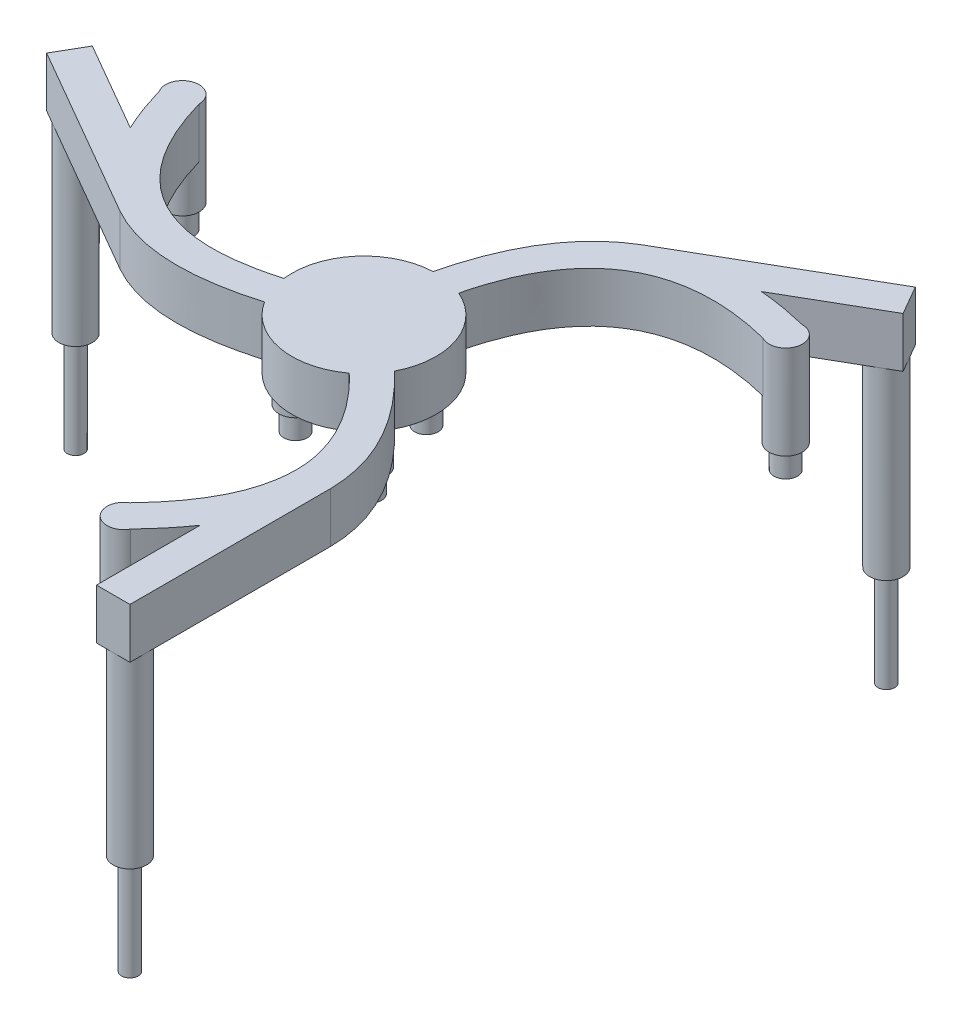
from build123d import *

# Parameters (mm, degrees)
BOSS_EXTRUDE2_DEPTH = 15
SKETCH4_R           = 5
BOSS_EXTRUDE3_DEPTH = 55
SKETCH5_R           = 2.5
BOSS_EXTRUDE5_DEPTH = 30
BOSS_EXTRUDE6_START = 20
SKETCH6_R           = 5
BOSS_EXTRUDE6_DEPTH = 20
SKETCH9_R           = 5
BOSS_EXTRUDE7_DEPTH = 20
SKETCH10_R          = 5
SKETCH10_R_2        = 3.5
CUT_EXTRUDE1_DEPTH  = 7


# Read off the part's stored shape, not the designer's step: Boss-Extrude2
with BuildPart() as part:
    # Boss-Extrude2 outline → Boss-Extrude2 (new body)
    with BuildSketch(Plane(origin=(0, 0, 0), x_dir=(1, 0, 0), z_dir=(0, 1, 0))):
        with BuildLine():
            ThreePointArc((-79.301270189, 80.000000278), (-85.640172505, 84.817399775), (-88.584206568, 77.419989152))
            add(Edge.make_bspline(
                [(-88.584206568, 77.419989152), (-86.367928891, 69.782262616), (-83.408582461, 63.514951385)],
                knots=[0.02157692, 0.02157692, 0.02157692, 0.151234515, 0.151234515, 0.151234515], degree=2))
            Line((-83.408582461, 63.514951385), (-110.262794416, 79.019237886))
            Line((-110.262794416, 79.019237886), (-115.262794416, 70.358983849))
            Line((-115.262794416, 70.358983849), (-63.301270189, 40.358983849))
            add(Edge.make_bspline(
                [(-63.301270189, 40.358983849), (-45.646570728, 30.396854404), (-18.218994006, 38.458495307)],
                knots=[0.484299762, 0.484299762, 0.484299762, 0.954512817, 0.954512817, 0.954512817], degree=2))
            ThreePointArc((-18.218994006, 38.458495307), (-3.922368216, 28.792616834), (12.885706155, 32.705589052))
            add(Edge.make_bspline(
                [(29.05383915, 7.474920109), (25.9728438, 20.230319759), (12.885706155, 32.705589052)],
                knots=[0.594463111, 0.594463111, 0.594463111, 0.969398026, 0.969398026, 0.969398026], degree=2))
            ThreePointArc((29.05383915, 7.474920109), (29.76251984, 3.767281878), (30, 0))
            add(Edge.make_bspline(
                [(13.669872981, -33.676914536), (30.204968933, -16.604131181), (30, 0)],
                knots=[0, 0, 0, 0.484954637, 0.484954637, 0.484954637], degree=2))
            ThreePointArc((13.669872981, -33.676914536), (12.667333455, -41.575264764), (20.545696107, -40.426167838))
            add(Edge.make_bspline(
                [(20.545696107, -40.426167838), (26.052022476, -34.6879518), (30, -28.991426998)],
                knots=[0.02157692, 0.02157692, 0.02157692, 0.151234515, 0.151234515, 0.151234515], degree=2))
            Line((30, -28.991426998), (30, -60))
            Line((30, -60), (40, -60))
            Line((40, -60), (40, 0))
            add(Edge.make_bspline(
                [(40, 0), (39.800107444, 20.270482952), (19.104733265, 39.992640706)],
                knots=[0.484299762, 0.484299762, 0.484299762, 0.954512817, 0.954512817, 0.954512817], degree=2))
            ThreePointArc((19.104733265, 39.992640706), (20.327316677, 57.206821065), (8.534546147, 69.80655435))
            add(Edge.make_bspline(
                [(65.631397208, 103.676914536), (19.549675952, 115.237660492), (8.534546147, 69.80655435)],
                knots=[0, 0, 0, 0.969398026, 0.969398026, 0.969398026], degree=2))
            ThreePointArc((65.631397208, 103.676914536), (72.972838916, 106.757864952), (68.038510461, 113.006178686))
            add(Edge.make_bspline(
                [(68.038510461, 113.006178686), (60.315906416, 114.905689184), (53.408582461, 115.476475612)],
                knots=[0.02157692, 0.02157692, 0.02157692, 0.151234515, 0.151234515, 0.151234515], degree=2))
            Line((53.408582461, 115.476475612), (80.262794416, 130.980762114))
            Line((80.262794416, 130.980762114), (75.262794416, 139.641016151))
            Line((75.262794416, 139.641016151), (23.301270189, 109.641016151))
            add(Edge.make_bspline(
                [(23.301270189, 109.641016151), (5.846463284, 99.332662644), (-0.885739259, 71.548863987)],
                knots=[0.484299762, 0.484299762, 0.484299762, 0.954512817, 0.954512817, 0.954512817], degree=2))
            ThreePointArc((-0.885739259, 71.548863987), (-16.404948461, 64.000562101), (-21.420252302, 47.487856599))
            add(Edge.make_bspline(
                [(-79.301270189, 80.000000278), (-66.272309422, 34.311685724), (-21.420252302, 47.487856599)],
                knots=[0, 0, 0, 0.969398026, 0.969398026, 0.969398026], degree=2))
        make_face()
    extrude(amount=BOSS_EXTRUDE2_DEPTH)

    # Sketch4 → Boss-Extrude3 (add)
    with BuildSketch(Plane.XZ):
        with Locations(Location((-108.432667397, -72.189110868, 0), (0, 0, 120))):
            Circle(SKETCH4_R)
        with Locations(Location((35, 55, 0), (0, 0, 90))):
            Circle(SKETCH4_R)
        with Locations(Location((73.432667397, -132.810889132, 0), (0, 0, 60))):
            Circle(SKETCH4_R)
    extrude(amount=BOSS_EXTRUDE3_DEPTH)

    # Sketch5 → Boss-Extrude5 (add)
    with BuildSketch(Plane.XZ.offset(55)):
        with Locations(Location((35, 55, 0), (0, 0, 270))):
            Circle(SKETCH5_R)
        with Locations(Location((73.432667397, -132.810889132, 0), (0, 0, 270))):
            Circle(SKETCH5_R)
        with Locations(Location((-108.432667397, -72.189110868, 0), (0, 0, 270))):
            Circle(SKETCH5_R)
    extrude(amount=BOSS_EXTRUDE5_DEPTH)

    # Sketch6 → Boss-Extrude6 (add)
    with BuildSketch(Plane.XZ.offset(BOSS_EXTRUDE6_START)):
        with Locations(Location((16.169872981, 38.007041555, 0), (0, 0, 270))):
            Circle(SKETCH6_R)
        with Locations(Location((-84.301270189, -80, 0), (0, 0, 270))):
            Circle(SKETCH6_R)
        with Locations(Location((68.131397208, -108.007041555, 0), (0, 0, 270))):
            Circle(SKETCH6_R)
    extrude(amount=-BOSS_EXTRUDE6_DEPTH)

    # Sketch9 → Boss-Extrude7 (add)
    with BuildSketch(Plane.XZ):
        with Locations(Location((-15.107039064, -44.643969537, 0), (0, 0, 90))):
            Circle(SKETCH9_R)
        with Locations(Location((12.191977977, -39.594935626, 0), (0, 0, 90))):
            Circle(SKETCH9_R)
        with Locations(Location((2.915061087, -65.761094837, 0), (0, 0, 90))):
            Circle(SKETCH9_R)
    extrude(amount=BOSS_EXTRUDE7_DEPTH)

    # Sketch10 → Cut-Extrude1 (cut)
    # profile 1 of 6: a face of its own
    with BuildSketch(Plane(origin=(0, -20, 0), x_dir=(-1, 0, 0), z_dir=(0, -1, 0))):
        with Locations(Location((-16.169872981, -38.007041555, 0), (0, 0, 90))):
            Circle(SKETCH10_R)
        with Locations(Location((-16.169872981, -38.007041555, 0), (0, 0, 90))):
            Circle(SKETCH10_R_2, mode=Mode.SUBTRACT)
    # profile 2 of 6: a face of its own
    with BuildSketch(Plane(origin=(0, -20, 0), x_dir=(-1, 0, 0), z_dir=(0, -1, 0))):
        with Locations(Location((-68.131397208, 108.007041555, 0), (0, 0, 90))):
            Circle(SKETCH10_R)
        with Locations(Location((-68.131397208, 108.007041555, 0), (0, 0, 90))):
            Circle(SKETCH10_R_2, mode=Mode.SUBTRACT)
    # profile 3 of 6: a face of its own
    with BuildSketch(Plane(origin=(0, -20, 0), x_dir=(-1, 0, 0), z_dir=(0, -1, 0))):
        with Locations(Location((-12.191977977, 39.594935626, 0), (0, 0, 270))):
            Circle(SKETCH10_R)
        with Locations(Location((-12.191977977, 39.594935626, 0), (0, 0, 90))):
            Circle(SKETCH10_R_2, mode=Mode.SUBTRACT)
    # profile 4 of 6: a face of its own
    with BuildSketch(Plane(origin=(0, -20, 0), x_dir=(-1, 0, 0), z_dir=(0, -1, 0))):
        with Locations(Location((-2.915061087, 65.761094837, 0), (0, 0, 270))):
            Circle(SKETCH10_R)
        with Locations(Location((-2.915061087, 65.761094837, 0), (0, 0, 90))):
            Circle(SKETCH10_R_2, mode=Mode.SUBTRACT)
    # profile 5 of 6: a face of its own
    with BuildSketch(Plane(origin=(0, -20, 0), x_dir=(-1, 0, 0), z_dir=(0, -1, 0))):
        with Locations(Location((15.107039064, 44.643969537, 0), (0, 0, 270))):
            Circle(SKETCH10_R)
        with Locations(Location((15.107039064, 44.643969537, 0), (0, 0, 90))):
            Circle(SKETCH10_R_2, mode=Mode.SUBTRACT)
    # profile 6 of 6: a face of its own
    with BuildSketch(Plane(origin=(0, -20, 0), x_dir=(-1, 0, 0), z_dir=(0, -1, 0))):
        with Locations(Location((84.301270189, 80, 0), (0, 0, 90))):
            Circle(SKETCH10_R)
        with Locations(Location((84.301270189, 80, 0), (0, 0, 90))):
            Circle(SKETCH10_R_2, mode=Mode.SUBTRACT)
    extrude(amount=-CUT_EXTRUDE1_DEPTH, mode=Mode.SUBTRACT)


solid = part.part
